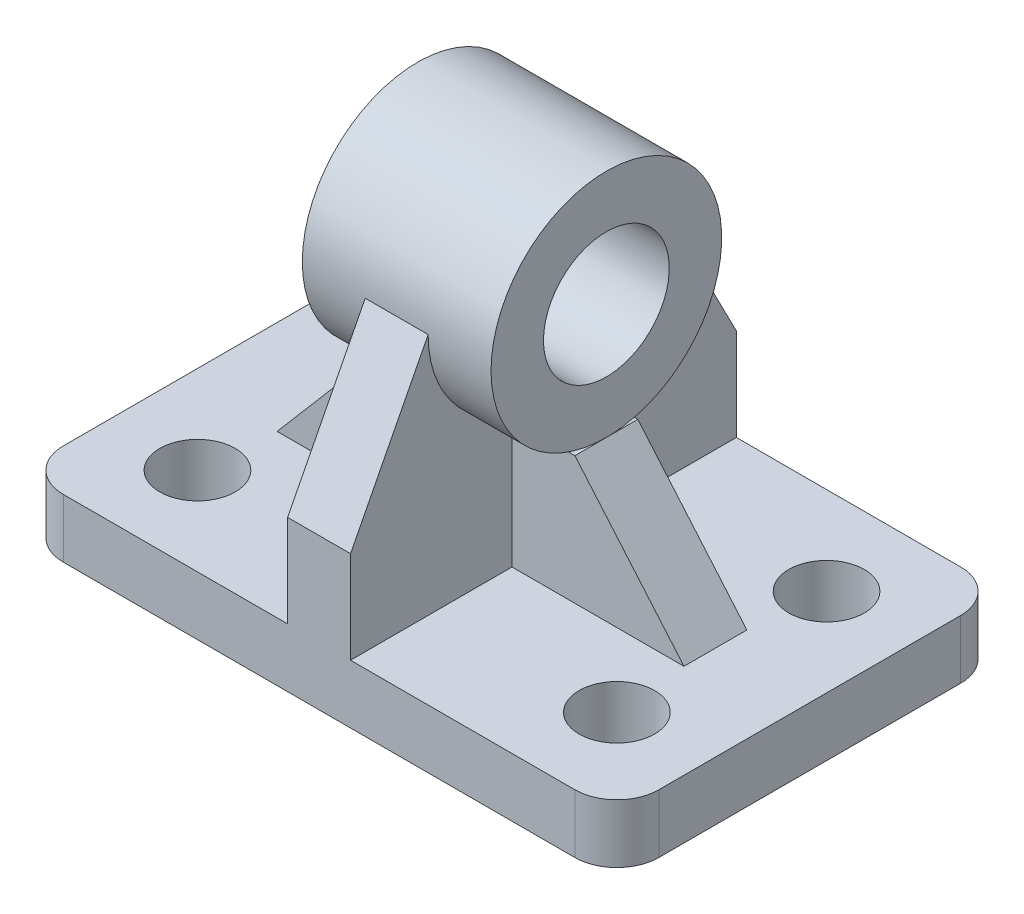
from build123d import *

# Parameters (mm, degrees)
SKETCH1_R                = 9
BOSS_EXTRUDE1_DEPTH      = 14
BOSS_EXTRUDE1_2_DEPTH    = 14
SKETCH1_5_W              = 15
SKETCH1_5_H              = 38.5
BOSS_EXTRUDE2_DEPTH      = 36
BOSS_EXTRUDE3_DEPTH      = 44.5
CUT_EXTRUDE1_REACH       = 101.416
SKETCH3_R                = 27.5
SKETCH3_R_2              = 15
BOSS_EXTRUDE4_DEPTH      = 22.5
BOSS_EXTRUDE19_START     = -7.5
BOSS_EXTRUDE19_OUTLINE_R = 15
BOSS_EXTRUDE19_DEPTH     = 15
BOSS_EXTRUDE19_2_DEPTH   = 15
SKETCH4_R                = 15
CUT_EXTRUDE2_DEPTH       = 87.5


# Read off the part's stored shape, not the designer's step: Boss-Extrude19
with BuildPart() as part:
    # Sketch1 → Boss-Extrude1 (new body)
    with BuildSketch(Plane(origin=(0, 0, 0), x_dir=(1, 0, 0), z_dir=(0, 1, 0))):
        with BuildLine():
            Line((-7.5, 7.5), (-7.5, 46))
            Line((-7.5, 46), (-61, 46))
            ThreePointArc((-61, 46), (-68.071067812, 43.071067812), (-71, 36))
            Line((-71, 36), (-71, -36))
            ThreePointArc((-71, -36), (-68.071067812, -43.071067812), (-61, -46))
            Line((-61, -46), (-7.5, -46))
            Line((-7.5, -46), (-7.5, -7.5))
            Line((-7.5, -7.5), (-48.5, -7.5))
            Line((-48.5, -7.5), (-48.5, 7.5))
            Line((-48.5, 7.5), (-7.5, 7.5))
        make_face()
        with Locations(Location((-50, -25, 0), (0, 0, 270))):
            Circle(SKETCH1_R, mode=Mode.SUBTRACT)
        with Locations(Location((-50, 25, 0), (0, 0, 270))):
            Circle(SKETCH1_R, mode=Mode.SUBTRACT)
    extrude(amount=BOSS_EXTRUDE1_DEPTH)



with BuildPart() as body_2:
    # Sketch1 → Boss-Extrude1 2 (new body)
    with BuildSketch(Plane(origin=(0, 0, 0), x_dir=(1, 0, 0), z_dir=(0, 1, 0))):
        with BuildLine():
            ThreePointArc((71, 36), (68.071067812, 43.071067812), (61, 46))
            Line((61, 46), (7.5, 46))
            Line((7.5, 46), (7.5, 7.5))
            Line((7.5, 7.5), (48.5, 7.5))
            Line((48.5, 7.5), (48.5, -7.5))
            Line((48.5, -7.5), (7.5, -7.5))
            Line((7.5, -7.5), (7.5, -46))
            Line((7.5, -46), (61, -46))
            ThreePointArc((61, -46), (68.071067812, -43.071067812), (71, -36))
            Line((71, -36), (71, 36))
        make_face()
        with Locations(Location((50, -25, 0), (0, 0, 270))):
            Circle(SKETCH1_R, mode=Mode.SUBTRACT)
        with Locations(Location((50, 25, 0), (0, 0, 270))):
            Circle(SKETCH1_R, mode=Mode.SUBTRACT)
    extrude(amount=BOSS_EXTRUDE1_2_DEPTH)


with BuildPart() as part_1:
    add(part.part)

    add(body_2.part)  # Boss-Extrude2 merges body 2
    # Sketch1<5> → Boss-Extrude2 (add)
    with BuildSketch(Plane(origin=(0, 0, 0), x_dir=(1, 0, 0), z_dir=(0, 1, 0))):
        with Locations((0, -26.75)):
            Rectangle(SKETCH1_5_W, SKETCH1_5_H)
        with Locations((0, 26.75)):
            Rectangle(SKETCH1_5_W, SKETCH1_5_H)
    extrude(amount=BOSS_EXTRUDE2_DEPTH)

    # Sketch1<8> → Boss-Extrude3 (add)
    with BuildSketch(Plane(origin=(0, 0, 0), x_dir=(1, 0, 0), z_dir=(0, 1, 0))):
        Polygon((48.5, 7.5), (7.5, 7.5), (-7.5, 7.5), (-48.5, 7.5), (-48.5, -7.5), (-7.5, -7.5), (7.5, -7.5), (48.5, -7.5), align=None)
    extrude(amount=BOSS_EXTRUDE3_DEPTH)

    # Sketch2 → Cut-Extrude1 (cut, up to next)
    with BuildSketch(Plane.XY.offset(7.5), mode=Mode.PRIVATE) as cut_extrude1_sk1:
        Polygon((-22.5, 44.5), (-48.5, 14), (-48.5, 44.5), align=None)
    cut_extrude1_tool1 = extrude(cut_extrude1_sk1.sketch, amount=-CUT_EXTRUDE1_REACH, mode=Mode.PRIVATE) & part_1.part
    # Sketch2 → Cut-Extrude1 (cut, up to next)
    with BuildSketch(Plane.XY.offset(7.5), mode=Mode.PRIVATE) as cut_extrude1_sk2:
        Polygon((22.5, 44.5), (48.5, 14), (48.5, 44.5), align=None)
    cut_extrude1_tool2 = extrude(cut_extrude1_sk2.sketch, amount=-CUT_EXTRUDE1_REACH, mode=Mode.PRIVATE) & part_1.part
    add(cut_extrude1_tool1.solids().sort_by_distance((-39.833333, 34.333333, 7.5))[0], mode=Mode.SUBTRACT)
    add(cut_extrude1_tool2.solids().sort_by_distance((39.833333, 34.333333, 7.5))[0], mode=Mode.SUBTRACT)

    # Boss-Extrude19 2 outline → Boss-Extrude19 2 (add)
    with BuildSketch(Plane(origin=(0, 0, 0), x_dir=(0, 0, -1), z_dir=(1, 0, 0)).offset(BOSS_EXTRUDE19_START)):
        with BuildLine():
            Line((46, 36), (27.5, 72))
            ThreePointArc((27.5, 72), (19.445436483, 52.554563517), (0, 44.5))
            Line((0, 44.5), (7.5, 44.5))
            Line((7.5, 44.5), (7.5, 36))
            Line((7.5, 36), (46, 36))
        make_face()
        with BuildLine():
            Line((-7.5, 44.5), (0, 44.5))
            ThreePointArc((0, 44.5), (-19.445436483, 52.554563517), (-27.5, 72))
            Line((-27.5, 72), (-46, 36))
            Line((-46, 36), (-7.5, 36))
            Line((-7.5, 36), (-7.5, 44.5))
        make_face()
    extrude(amount=BOSS_EXTRUDE19_2_DEPTH)


with BuildPart() as body_2_2:
    # Sketch3 → Boss-Extrude4 (new, symmetric)
    with BuildSketch(Plane(origin=(0, 0, 0), x_dir=(0, 0, -1), z_dir=(1, 0, 0))):
        with Locations(Location((0, 72, 0), (0, 0, 180))):
            Circle(SKETCH3_R)
        with Locations(Location((0, 72, 0), (0, 0, 180))):
            Circle(SKETCH3_R_2, mode=Mode.SUBTRACT)
    extrude(amount=BOSS_EXTRUDE4_DEPTH, both=True)

    # Boss-Extrude19 outline → Boss-Extrude19 (add)
    with BuildSketch(Plane(origin=(0, 0, 0), x_dir=(0, 0, -1), z_dir=(1, 0, 0)).offset(BOSS_EXTRUDE19_START)):
        with Locations((0, 72)):
            Circle(BOSS_EXTRUDE19_OUTLINE_R)
    extrude(amount=BOSS_EXTRUDE19_DEPTH)

    # Sketch4 → Cut-Extrude2 (cut, symmetric)
    with BuildSketch(Plane(origin=(7.5, 0, 0), x_dir=(0, 0, -1), z_dir=(1, 0, 0))):
        with Locations(Location((0, 72, 0), (0, 0, 180))):
            Circle(SKETCH4_R)
    extrude(amount=CUT_EXTRUDE2_DEPTH, both=True, mode=Mode.SUBTRACT)


solid = Compound([part_1.part, body_2_2.part])
